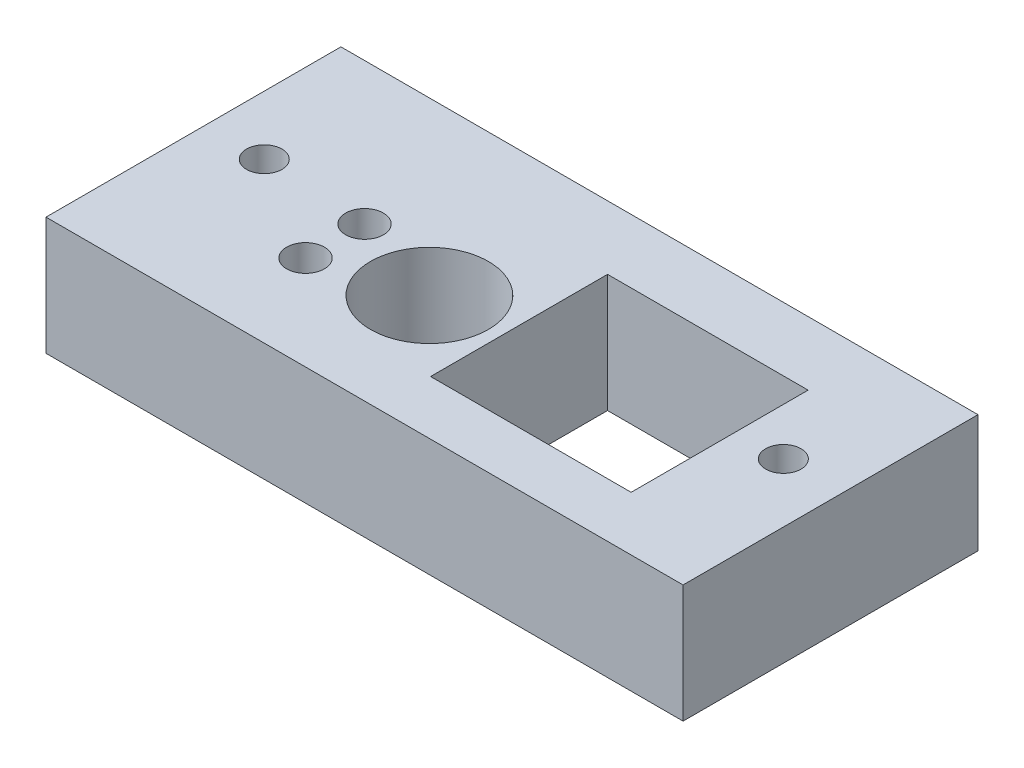
from build123d import *

# Parameters (mm, degrees)
SKETCH1_W           = 54
SKETCH1_H           = 25
BOSS_EXTRUDE1_DEPTH = 10
SKETCH2_R           = 1.5
SKETCH2_R_2         = 5
SKETCH2_R_3         = 1.6
SKETCH2_W           = 17
SKETCH2_H           = 15
CUT_EXTRUDE1_DEPTH  = 10


with BuildPart() as part:
    # Sketch1 → Boss-Extrude1 (new body)
    with BuildSketch(Plane(origin=(0, 0, 0), x_dir=(1, 0, 0), z_dir=(0, 1, 0))):
        with Locations((27, 12.5)):
            Rectangle(SKETCH1_W, SKETCH1_H)
    extrude(amount=BOSS_EXTRUDE1_DEPTH)

    # Sketch2 → Cut-Extrude1 (cut)
    with BuildSketch(Plane(origin=(0, 10, 0), x_dir=(1, 0, 0), z_dir=(0, 1, 0))):
        with Locations((49, 13.5)):
            Circle(SKETCH2_R)
        with Locations((5, 13.5)):
            Circle(SKETCH2_R)
        with Locations((22, 10.5)):
            Circle(SKETCH2_R_2)
        with Locations((14, 13)):
            Circle(SKETCH2_R_3)
        with Locations((14, 8)):
            Circle(SKETCH2_R_3)
        with Locations((36.5, 12.1)):
            Rectangle(SKETCH2_W, SKETCH2_H)
    extrude(amount=-CUT_EXTRUDE1_DEPTH, mode=Mode.SUBTRACT)


solid = part.part
